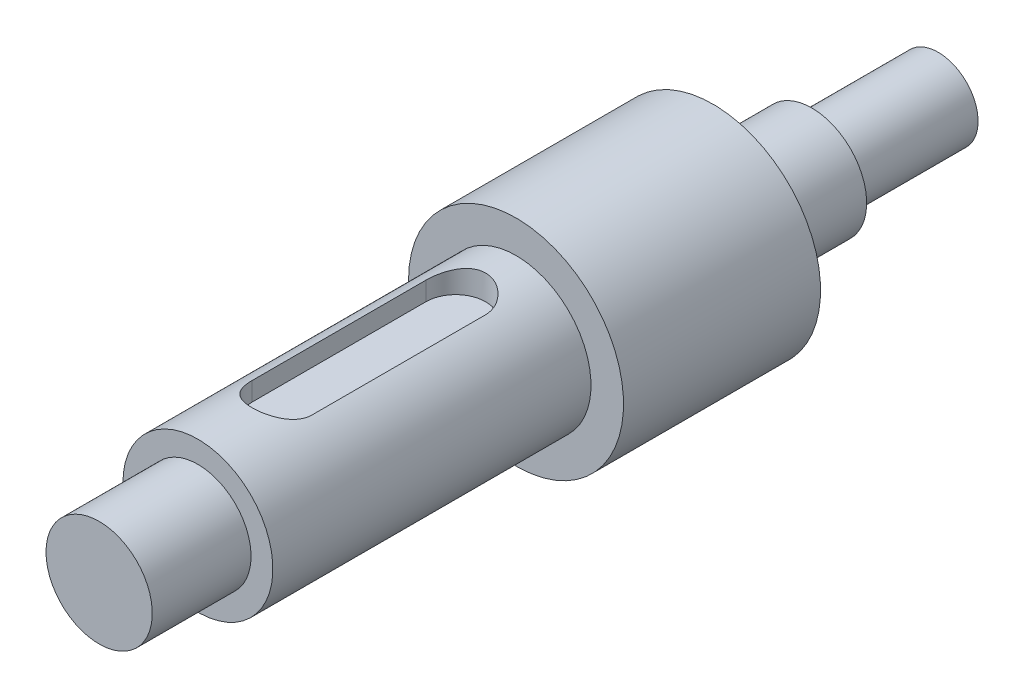
from build123d import *

# Parameters (mm, degrees)
CUT_EXTRUDE1_DEPTH = 5


with BuildPart() as part:
    # Sketch1 → Revolve1 (revolve)
    with BuildSketch(Plane(origin=(0, 0, 0), x_dir=(1, 0, 0), z_dir=(0, 1, 0))):
        Polygon((0.318441737, -12.748624922), (0.318441737, -181.058565549), (10.978095848, -181.058565549), (10.978095848, -161.246565549), (15.355100956, -161.246565549), (15.355100956, -97.433725172), (21.885017704, -97.433725172), (21.885017704, -57.912), (11.317371982, -57.912), (11.317371982, -38.1), (8.317371982, -38.1), (8.317371982, -12.748624922), align=None)
    revolve(axis=Axis((0.318441737, 0, 12.748624922), (0, 0, 1)))

    # Sketch3 → Cut-Extrude1 (cut)
    with BuildSketch(Plane(origin=(-7.244777378, 15.036659219, 97.433725172), x_dir=(0, 0, -1), z_dir=(0, -1, 0))):
        with BuildLine():
            Line((-12.090766419, 13.563219115), (-46.923749454, 13.563219115))
            ThreePointArc((-46.923749454, 13.563219115), (-52.923749454, 7.563219115), (-46.923749454, 1.563219115))
            Line((-46.923749454, 1.563219115), (-12.090766419, 1.563219115))
            ThreePointArc((-12.090766419, 1.563219115), (-6.090766419, 7.563219115), (-12.090766419, 13.563219115))
        make_face()
    extrude(amount=CUT_EXTRUDE1_DEPTH, mode=Mode.SUBTRACT)


solid = part.part
